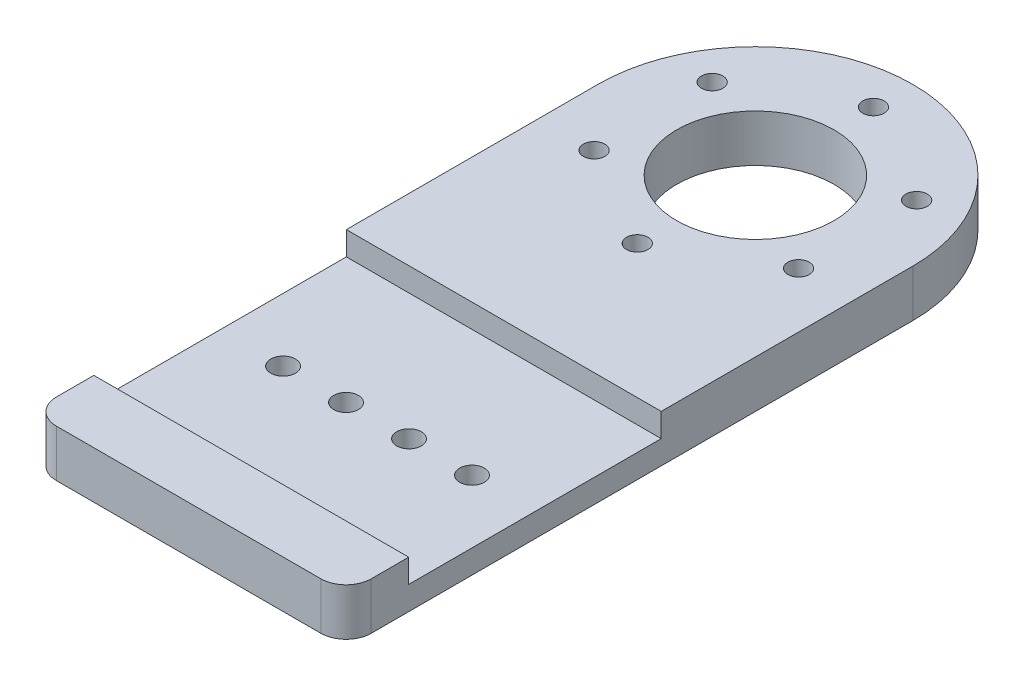
from build123d import *

# Parameters (mm, degrees)
SKETCH1_W             = 63.5
SKETCH1_H             = 12.6365
BOSS_EXTRUDE2_DEPTH   = 9.525
SKETCH1_R             = 15.875
BOSS_EXTRUDE2_2_DEPTH = 9.525
SKETCH1_3_W           = 63.5
SKETCH1_3_H           = 50.927
SKETCH1_3_R           = 2.4892
BOSS_EXTRUDE3_DEPTH   = 4.7625
SKETCH2_R             = 2.159
CUT_EXTRUDE1_DEPTH    = 160.541775485
FILLET1_R             = 5.08


with BuildPart() as part:
    # Sketch1 → Boss-Extrude2 (new body)
    with BuildSketch(Plane(origin=(0, 0, 0), x_dir=(1, 0, 0), z_dir=(0, 1, 0))):
        with Locations((31.75, 6.31825)):
            Rectangle(SKETCH1_W, SKETCH1_H)
    extrude(amount=BOSS_EXTRUDE2_DEPTH)



with BuildPart() as body_2:
    # Sketch1 → Boss-Extrude2 2 (new body)
    with BuildSketch(Plane(origin=(0, 0, 0), x_dir=(1, 0, 0), z_dir=(0, 1, 0))):
        with BuildLine():
            Line((0, 114.3), (0, 63.5635))
            Line((0, 63.5635), (63.5, 63.5635))
            Line((63.5, 63.5635), (63.5, 114.3))
            ThreePointArc((63.5, 114.3), (31.75, 146.05), (0, 114.3))
        make_face()
        with Locations((31.75, 114.3)):
            Circle(SKETCH1_R, mode=Mode.SUBTRACT)
    extrude(amount=BOSS_EXTRUDE2_2_DEPTH)


with BuildPart() as part_1:
    add(part.part)

    add(body_2.part)  # Boss-Extrude3 merges body 2
    # Sketch1<3> → Boss-Extrude3 (add)
    with BuildSketch(Plane(origin=(0, 0, 0), x_dir=(1, 0, 0), z_dir=(0, 1, 0))):
        with Locations((31.75, 38.1)):
            Rectangle(SKETCH1_3_W, SKETCH1_3_H)
        with Locations((12.7, 38.1)):
            Circle(SKETCH1_3_R, mode=Mode.SUBTRACT)
        with Locations((25.4, 38.1)):
            Circle(SKETCH1_3_R, mode=Mode.SUBTRACT)
        with Locations((38.1, 38.1)):
            Circle(SKETCH1_3_R, mode=Mode.SUBTRACT)
        with Locations((50.8, 38.1)):
            Circle(SKETCH1_3_R, mode=Mode.SUBTRACT)
    extrude(amount=BOSS_EXTRUDE3_DEPTH)

    # Sketch2 → Cut-Extrude1 (cut, through all)
    with BuildSketch(Plane.XZ):
        with Locations((11.127770072, -102.39375)):
            Circle(SKETCH2_R)
        with Locations((31.75, -90.4875)):
            Circle(SKETCH2_R)
        with Locations((52.372229928, -102.39375)):
            Circle(SKETCH2_R)
        with Locations((52.372229928, -126.20625)):
            Circle(SKETCH2_R)
        with Locations((31.75, -138.1125)):
            Circle(SKETCH2_R)
        with Locations((11.127770072, -126.20625)):
            Circle(SKETCH2_R)
    extrude(amount=-CUT_EXTRUDE1_DEPTH, mode=Mode.SUBTRACT)

    # Fillet1
    fillet1_edges = [part_1.edges().sort_by_distance(p)[0] for p in [
        (0, 4.7625, 0),
        (63.5, 4.7625, 0),
    ]]
    fillet(fillet1_edges, radius=FILLET1_R)


solid = part_1.part
